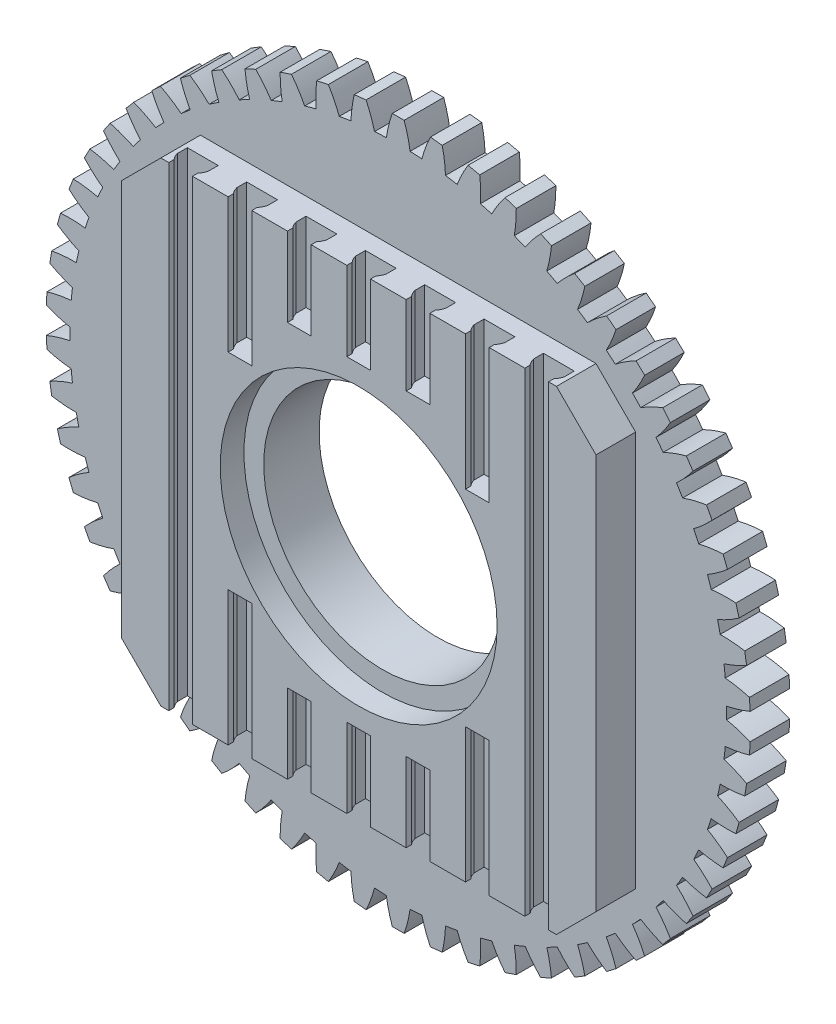
from build123d import *

# Parameters (mm, degrees)
SKETCH_1_R          = 41.5
EXTRUDE_1_DEPTH     = 5
SKETCH_2_W          = 60
SKETCH_2_H          = 60
EXTRUDE_2_DEPTH     = 5
CUT_EXTRUDE_1_DEPTH = 10
CUT_EXTRUDE_START   = -50
CUT_EXTRUDE_2_DEPTH = 10
CUT_EXTRUDE_3_DEPTH = 17
CUT_EXTRUDE_START_2 = -43
CUT_EXTRUDE_4_DEPTH = 17
CUT_EXTRUDE_5_REACH = 84.822
CHAMFER_1_SIZE      = 5
SKETCH_6_R          = 17.5
CUT_EXTRUDE_6_DEPTH = 3
SKETCH_7_R          = 15
CUT_EXTRUDE_7_DEPTH = 60.105837275
SKETCH_9_R          = 39.5
SKETCH_9_R_2        = 19
CUT_EXTRUDE_8_DEPTH = 3
EXTRUDE_START       = -5
EXTRUDE_3_DEPTH     = 5


with BuildPart() as part:
    # 草图1 → 凸台-拉伸1 (new body)
    with BuildSketch(Plane.XY):
        Circle(SKETCH_1_R)
    extrude(amount=-EXTRUDE_1_DEPTH)

    # 草图2 → 凸台-拉伸2 (add)
    with BuildSketch(Plane.XY):
        Rectangle(SKETCH_2_W, SKETCH_2_H)
    extrude(amount=EXTRUDE_2_DEPTH)

    # 草图3 → 切除-拉伸1 (cut)
    with BuildSketch(Plane.XZ.offset(30)):
        with BuildLine():
            Line((-1.5, 5), (1.5, 5))
            Line((1.5, 5), (1.5, 4.322875656))
            ThreePointArc((1.5, 4.322875656), (1.780042303, 3.911838473), (1.95, 3.444409721))
            Line((1.95, 3.444409721), (1.95, 2.2))
            Line((1.95, 2.2), (-1.95, 2.2))
            Line((-1.95, 2.2), (-1.95, 3.444409721))
            ThreePointArc((-1.95, 3.444409721), (-1.780042303, 3.911838473), (-1.5, 4.322875656))
            Line((-1.5, 4.322875656), (-1.5, 5))
        make_face()
        with BuildLine():
            Line((6, 5), (6, 4.322875656))
            ThreePointArc((6, 4.322875656), (5.719957697, 3.911838473), (5.55, 3.444409721))
            Line((5.55, 3.444409721), (5.55, 2.2))
            Line((5.55, 2.2), (9.45, 2.2))
            Line((9.45, 2.2), (9.45, 3.444409721))
            ThreePointArc((9.45, 3.444409721), (9.280042303, 3.911838473), (9, 4.322875656))
            Line((9, 4.322875656), (9, 5))
            Line((9, 5), (6, 5))
        make_face()
        with BuildLine():
            Line((-9, 5), (-9, 4.322875656))
            ThreePointArc((-9, 4.322875656), (-9.280042303, 3.911838473), (-9.45, 3.444409721))
            Line((-9.45, 3.444409721), (-9.45, 2.2))
            Line((-9.45, 2.2), (-5.55, 2.2))
            Line((-5.55, 2.2), (-5.55, 3.444409721))
            ThreePointArc((-5.55, 3.444409721), (-5.719957697, 3.911838473), (-6, 4.322875656))
            Line((-6, 4.322875656), (-6, 5))
            Line((-6, 5), (-9, 5))
        make_face()
    extrude(amount=-CUT_EXTRUDE_1_DEPTH, mode=Mode.SUBTRACT)

    # 草图3<2> → 切除-拉伸2 (cut)
    with BuildSketch(Plane.XZ.offset(30).offset(CUT_EXTRUDE_START)):
        with BuildLine():
            Line((-1.5, 5), (1.5, 5))
            Line((1.5, 5), (1.5, 4.322875656))
            ThreePointArc((1.5, 4.322875656), (1.780042303, 3.911838473), (1.95, 3.444409721))
            Line((1.95, 3.444409721), (1.95, 2.2))
            Line((1.95, 2.2), (-1.95, 2.2))
            Line((-1.95, 2.2), (-1.95, 3.444409721))
            ThreePointArc((-1.95, 3.444409721), (-1.780042303, 3.911838473), (-1.5, 4.322875656))
            Line((-1.5, 4.322875656), (-1.5, 5))
        make_face()
        with BuildLine():
            Line((6, 5), (6, 4.322875656))
            ThreePointArc((6, 4.322875656), (5.719957697, 3.911838473), (5.55, 3.444409721))
            Line((5.55, 3.444409721), (5.55, 2.2))
            Line((5.55, 2.2), (9.45, 2.2))
            Line((9.45, 2.2), (9.45, 3.444409721))
            ThreePointArc((9.45, 3.444409721), (9.280042303, 3.911838473), (9, 4.322875656))
            Line((9, 4.322875656), (9, 5))
            Line((9, 5), (6, 5))
        make_face()
        with BuildLine():
            Line((-9, 5), (-9, 4.322875656))
            ThreePointArc((-9, 4.322875656), (-9.280042303, 3.911838473), (-9.45, 3.444409721))
            Line((-9.45, 3.444409721), (-9.45, 2.2))
            Line((-9.45, 2.2), (-5.55, 2.2))
            Line((-5.55, 2.2), (-5.55, 3.444409721))
            ThreePointArc((-5.55, 3.444409721), (-5.719957697, 3.911838473), (-6, 4.322875656))
            Line((-6, 4.322875656), (-6, 5))
            Line((-6, 5), (-9, 5))
        make_face()
    extrude(amount=-CUT_EXTRUDE_2_DEPTH, mode=Mode.SUBTRACT)

    # 草图4 → 切除-拉伸3 (cut)
    with BuildSketch(Plane.XZ.offset(30)):
        with BuildLine():
            Line((-16.5, 5), (-13.5, 5))
            Line((-13.5, 5), (-13.5, 4.322875656))
            ThreePointArc((-13.5, 4.322875656), (-13.219957697, 3.911838473), (-13.05, 3.444409721))
            Line((-13.05, 3.444409721), (-13.05, 2.2))
            Line((-13.05, 2.2), (-16.95, 2.2))
            Line((-16.95, 2.2), (-16.95, 3.444409721))
            ThreePointArc((-16.95, 3.444409721), (-16.780042303, 3.911838473), (-16.5, 4.322875656))
            Line((-16.5, 4.322875656), (-16.5, 5))
        make_face()
        with BuildLine():
            Line((13.5, 5), (16.5, 5))
            Line((16.5, 5), (16.5, 4.322875656))
            ThreePointArc((16.5, 4.322875656), (16.780042303, 3.911838473), (16.95, 3.444409721))
            Line((16.95, 3.444409721), (16.95, 2.2))
            Line((16.95, 2.2), (13.05, 2.2))
            Line((13.05, 2.2), (13.05, 3.444409721))
            ThreePointArc((13.05, 3.444409721), (13.219957697, 3.911838473), (13.5, 4.322875656))
            Line((13.5, 4.322875656), (13.5, 5))
        make_face()
    extrude(amount=-CUT_EXTRUDE_3_DEPTH, mode=Mode.SUBTRACT)

    # 草图4<2> → 切除-拉伸4 (cut)
    with BuildSketch(Plane.XZ.offset(30).offset(CUT_EXTRUDE_START_2)):
        with BuildLine():
            Line((-16.5, 5), (-13.5, 5))
            Line((-13.5, 5), (-13.5, 4.322875656))
            ThreePointArc((-13.5, 4.322875656), (-13.219957697, 3.911838473), (-13.05, 3.444409721))
            Line((-13.05, 3.444409721), (-13.05, 2.2))
            Line((-13.05, 2.2), (-16.95, 2.2))
            Line((-16.95, 2.2), (-16.95, 3.444409721))
            ThreePointArc((-16.95, 3.444409721), (-16.780042303, 3.911838473), (-16.5, 4.322875656))
            Line((-16.5, 4.322875656), (-16.5, 5))
        make_face()
        with BuildLine():
            Line((13.5, 5), (16.5, 5))
            Line((16.5, 5), (16.5, 4.322875656))
            ThreePointArc((16.5, 4.322875656), (16.780042303, 3.911838473), (16.95, 3.444409721))
            Line((16.95, 3.444409721), (16.95, 2.2))
            Line((16.95, 2.2), (13.05, 2.2))
            Line((13.05, 2.2), (13.05, 3.444409721))
            ThreePointArc((13.05, 3.444409721), (13.219957697, 3.911838473), (13.5, 4.322875656))
            Line((13.5, 4.322875656), (13.5, 5))
        make_face()
    extrude(amount=-CUT_EXTRUDE_4_DEPTH, mode=Mode.SUBTRACT)

    # 草图5 → 切除-拉伸5 (cut, up to next)
    with BuildSketch(Plane.XZ.offset(30), mode=Mode.PRIVATE) as cut_extrude_5_sk1:
        with BuildLine():
            Line((-21, 5), (-21, 4.322875656))
            ThreePointArc((-21, 4.322875656), (-20.719957697, 3.911838473), (-20.55, 3.444409721))
            Line((-20.55, 3.444409721), (-20.55, 2.2))
            Line((-20.55, 2.2), (-24.45, 2.2))
            Line((-24.45, 2.2), (-24.45, 3.444409721))
            ThreePointArc((-24.45, 3.444409721), (-24.280042303, 3.911838473), (-24, 4.322875656))
            Line((-24, 4.322875656), (-24, 5))
            Line((-24, 5), (-21, 5))
        make_face()
    cut_extrude_5_tool1 = extrude(cut_extrude_5_sk1.sketch, amount=-CUT_EXTRUDE_5_REACH, mode=Mode.PRIVATE) & part.part
    # 草图5 → 切除-拉伸5 (cut, up to next)
    with BuildSketch(Plane.XZ.offset(30), mode=Mode.PRIVATE) as cut_extrude_5_sk2:
        with BuildLine():
            Line((24, 5), (24, 4.322875656))
            ThreePointArc((24, 4.322875656), (24.280042303, 3.911838473), (24.45, 3.444409721))
            Line((24.45, 3.444409721), (24.45, 2.2))
            Line((24.45, 2.2), (20.55, 2.2))
            Line((20.55, 2.2), (20.55, 3.444409721))
            ThreePointArc((20.55, 3.444409721), (20.719957697, 3.911838473), (21, 4.322875656))
            Line((21, 4.322875656), (21, 5))
            Line((21, 5), (24, 5))
        make_face()
    cut_extrude_5_tool2 = extrude(cut_extrude_5_sk2.sketch, amount=-CUT_EXTRUDE_5_REACH, mode=Mode.PRIVATE) & part.part
    add(cut_extrude_5_tool1.solids().sort_by_distance((-22.5, -30, 3.520698))[0], mode=Mode.SUBTRACT)
    add(cut_extrude_5_tool2.solids().sort_by_distance((22.5, -30, 3.520698))[0], mode=Mode.SUBTRACT)

    # 倒角1
    # the kernel refuses this chamfer: 5 mm, written as the material it takes off along each edge
    with BuildSketch(Plane(origin=(-30, 30, 0), x_dir=(0.9996219169112968, 0.027495876610586317, 0), z_dir=(0, 0, 1)), Plane(origin=(-30, -30, 0), x_dir=(-0.027495876610586317, 0.9996219169112968, 0), z_dir=(0, 0, 1)), Plane(origin=(30, 30, 0), x_dir=(0.027495876610586317, -0.9996219169112968, 0), z_dir=(0, 0, 1))) as chamfer_1_piece_1:
        Polygon((CHAMFER_1_SIZE * 0.999621916911, -CHAMFER_1_SIZE * 0.0274958766106), (-CHAMFER_1_SIZE * 0.0274958766106, -CHAMFER_1_SIZE * 0.999621916911), (0, 0), align=None)
    extrude(amount=17.85841494, mode=Mode.SUBTRACT)
    with BuildSketch(Plane(origin=(30, -30, 0), x_dir=(0.027495876610586317, 0.9996219169112968, 0), z_dir=(0, 0, 1))) as chamfer_1_piece_2:
        Polygon((CHAMFER_1_SIZE * 0.999621916911, CHAMFER_1_SIZE * 0.0274958766106), (-CHAMFER_1_SIZE * 0.0274958766106, CHAMFER_1_SIZE * 0.999621916911), (0, 0), align=None)
    extrude(amount=17.85841494, mode=Mode.SUBTRACT)

    # 草图6 → 切除-拉伸6 (cut)
    with BuildSketch(Plane.XY.offset(5)):
        Circle(SKETCH_6_R)
    extrude(amount=-CUT_EXTRUDE_6_DEPTH, mode=Mode.SUBTRACT)

    # 草图7 → 切除-拉伸7 (cut, through all)
    with BuildSketch(Plane.XY.offset(2)):
        Circle(SKETCH_7_R)
    extrude(amount=-CUT_EXTRUDE_7_DEPTH, mode=Mode.SUBTRACT)

    # 草图9 → 切除-拉伸8 (cut)
    with BuildSketch(Plane(origin=(0, 0, -5), x_dir=(-1, 0, 0), z_dir=(0, 0, -1))):
        Circle(SKETCH_9_R)
        Circle(SKETCH_9_R_2, mode=Mode.SUBTRACT)
    extrude(amount=-CUT_EXTRUDE_8_DEPTH, mode=Mode.SUBTRACT)

    # 草图8 → 凸台-拉伸3 (add)
    with BuildSketch(Plane(origin=(0, 0, -5), x_dir=(-1, 0, 0), z_dir=(0, 0, -1)).offset(EXTRUDE_START)):
        with BuildLine():
            Line((5.556899788, 44.15804983), (4.065692852, 44.320228357))
            ThreePointArc((4.065692852, 44.320228357), (3.457829001, 42.882253569), (2.992800434, 41.391945419))
            ThreePointArc((2.992800434, 41.391945419), (4.486939265, 41.256725222), (5.975214305, 41.067588364))
            ThreePointArc((5.975214305, 41.067588364), (5.841430046, 42.623021334), (5.556899788, 44.15804983))
        make_face()
        with BuildLine():
            Line((10.298650006, 43.298386899), (8.833719173, 43.620842559))
            ThreePointArc((8.833719173, 43.620842559), (8.073946223, 42.257018884), (7.450513019, 40.825725416))
            ThreePointArc((7.450513019, 40.825725416), (8.921273269, 40.529753062), (10.380374686, 40.180814096))
            ThreePointArc((10.380374686, 40.180814096), (10.415546562, 41.741593673), (10.298650006, 43.298386899))
        make_face()
        with BuildLine():
            Line((14.919657969, 41.93108997), (13.498178213, 42.410042265))
            ThreePointArc((13.498178213, 42.410042265), (12.595403808, 41.136359288), (11.820875151, 39.78086111))
            ThreePointArc((11.820875151, 39.78086111), (13.251013501, 39.327606604), (14.663834664, 38.82295652))
            ThreePointArc((14.663834664, 38.82295652), (14.867550317, 40.370783992), (14.919657969, 41.93108997))
        make_face()
        with BuildLine():
            Line((0.75, 44.5), (-0.75, 44.5))
            ThreePointArc((-0.75, 44.5), (-1.198828104, 43.004733039), (-1.5, 41.472882707))
            ThreePointArc((-1.5, 41.472882707), (0, 41.5), (1.5, 41.472882707))
            ThreePointArc((1.5, 41.472882707), (1.198828104, 43.004733039), (0.75, 44.5))
        make_face()
        with BuildLine():
            Line((19.365746584, 40.072189349), (18.004383455, 40.702023002))
            ThreePointArc((18.004383455, 40.702023002), (16.969191799, 39.533413491), (16.052648329, 38.26960258))
            ThreePointArc((16.052648329, 38.26960258), (17.425397715, 37.664379916), (18.775374588, 37.009935275))
            ThreePointArc((18.775374588, 37.009935275), (19.145245639, 38.52666378), (19.365746584, 40.072189349))
        make_face()
        with BuildLine():
            Line((23.584789527, 37.743478947), (22.299503762, 38.516809732))
            ThreePointArc((22.299503762, 38.516809732), (21.144031531, 37.466974567), (20.096218883, 36.309667949))
            ThreePointArc((20.096218883, 36.309667949), (21.395485073, 35.559572811), (22.666790412, 34.763006378))
            ThreePointArc((22.666790412, 34.763006378), (23.198480459, 36.23085366), (23.584789527, 37.743478947))
        make_face()
        with BuildLine():
            Line((27.527322375, 34.972260763), (26.333182777, 35.880022085))
            ThreePointArc((26.333182777, 35.880022085), (25.070976826, 34.961269622), (23.904179645, 33.92403566))
            ThreePointArc((23.904179645, 33.92403566), (25.114729931, 33.037862227), (26.292458842, 32.108513015))
            ThreePointArc((26.292458842, 32.108513015), (26.979734307, 33.510269908), (27.527322375, 34.972260763))
        make_face()
        with BuildLine():
            Line((31.147122538, 31.791024796), (30.0581293, 32.822573985))
            ThreePointArc((30.0581293, 32.822573985), (28.70398784, 32.045675756), (27.431885757, 31.14067507))
            ThreePointArc((27.431885757, 31.14067507), (28.539527542, 30.128812915), (29.609872232, 29.077576694))
            ThreePointArc((29.609872232, 29.077576694), (30.444675439, 30.396808879), (31.147122538, 31.791024796))
        make_face()
        with BuildLine():
            Line((34.401751167, 28.237068131), (33.43067174, 29.380311214))
            ThreePointArc((33.43067174, 29.380311214), (32.000470841, 28.754375642), (30.637978089, 27.992218537))
            ThreePointArc((30.637978089, 27.992218537), (31.629725288, 26.866530818), (32.580136943, 25.705732372))
            ThreePointArc((32.580136943, 25.705732372), (33.552680586, 26.926973058), (34.401751167, 28.237068131))
        make_face()
        with BuildLine():
            Line((37.253050717, 24.35205766), (36.411270119, 25.593591157))
            ThreePointArc((36.411270119, 25.593591157), (34.921777579, 25.125956764), (33.48486814, 24.515578836))
            ThreePointArc((33.48486814, 24.515578836), (34.349093424, 23.289263213), (35.168429336, 22.032511841))
            ThreePointArc((35.168429336, 22.032511841), (36.267311231, 23.141443098), (37.253050717, 24.35205766))
        make_face()
        with BuildLine():
            Line((39.667592308, 20.181541578), (38.964979647, 21.506809644))
            ThreePointArc((38.964979647, 21.506809644), (37.433658405, 21.202959015), (35.939178728, 20.751516387))
            ThreePointArc((35.939178728, 20.751516387), (36.665749845, 19.438950289), (37.34440405, 18.100980253))
            ThreePointArc((37.34440405, 18.100980253), (38.556740811, 19.084600876), (39.667592308, 20.181541578))
        make_face()
        with BuildLine():
            Line((41.617067648, 15.774415373), (41.061860415, 17.167880452))
            ThreePointArc((41.061860415, 17.167880452), (39.506663812, 17.031375958), (37.972135305, 16.744161381))
            ThreePointArc((37.972135305, 16.744161381), (38.552533872, 15.360733447), (39.082549771, 13.957231222))
            ThreePointArc((39.082549771, 13.957231222), (40.394127858, 14.804009158), (41.617067648, 15.774415373))
        make_face()
        with BuildLine():
            Line((43.078620921, 11.18234857), (42.677328413, 12.627673559))
            ThreePointArc((42.677328413, 12.627673559), (41.116489707, 12.66011559), (39.559903314, 12.540496393))
            ThreePointArc((39.559903314, 12.540496393), (39.98732469, 11.102426049), (40.36248833, 9.649846416))
            ThreePointArc((40.36248833, 9.649846416), (41.757930689, 10.349853968), (43.078620921, 11.18234857))
        make_face()
        with BuildLine():
            Line((44.035116751, 6.459178955), (43.792443756, 7.939418739))
            ThreePointArc((43.792443756, 7.939418739), (42.244262354, 8.140426942), (40.683867626, 8.189805551))
            ThreePointArc((40.683867626, 8.189805551), (40.953300685, 6.713952857), (41.169213616, 5.229325983))
            ThreePointArc((41.169213616, 5.229325983), (42.632159962, 5.774356203), (44.035116751, 6.459178955))
        make_face()
        with BuildLine():
            Line((44.475341098, 1.660281372), (44.394132735, 3.158081492))
            ThreePointArc((44.394132735, 3.158081492), (42.876759648, 3.52529923), (41.330850788, 3.743096726))
            ThreePointArc((41.330850788, 3.743096726), (41.439136675, 2.246764706), (41.493267514, 0.747496485))
            ThreePointArc((41.493267514, 0.747496485), (43.006566138, 1.131159391), (44.475341098, 1.660281372))
        make_face()
        with BuildLine():
            Line((44.394132735, -3.158081492), (44.475341098, -1.660281372))
            ThreePointArc((44.475341098, -1.660281372), (43.006566138, -1.131159391), (41.493267514, -0.747496485))
            ThreePointArc((41.493267514, -0.747496485), (41.439136675, -2.246764706), (41.330850788, -3.743096726))
            ThreePointArc((41.330850788, -3.743096726), (42.876759648, -3.52529923), (44.394132735, -3.158081492))
        make_face()
        with BuildLine():
            Line((43.792443756, -7.939418739), (44.035116751, -6.459178955))
            ThreePointArc((44.035116751, -6.459178955), (42.632159962, -5.774356203), (41.169213616, -5.229325983))
            ThreePointArc((41.169213616, -5.229325983), (40.953300685, -6.713952857), (40.683867626, -8.189805551))
            ThreePointArc((40.683867626, -8.189805551), (42.244262354, -8.140426942), (43.792443756, -7.939418739))
        make_face()
        with BuildLine():
            Line((42.677328413, -12.627673559), (43.078620921, -11.18234857))
            ThreePointArc((43.078620921, -11.18234857), (41.757930689, -10.349853968), (40.36248833, -9.649846416))
            ThreePointArc((40.36248833, -9.649846416), (39.98732469, -11.102426049), (39.559903314, -12.540496393))
            ThreePointArc((39.559903314, -12.540496393), (41.116489707, -12.66011559), (42.677328413, -12.627673559))
        make_face()
        with BuildLine():
            Line((41.061860415, -17.167880452), (41.617067648, -15.774415373))
            ThreePointArc((41.617067648, -15.774415373), (40.394127858, -14.804009158), (39.082549771, -13.957231222))
            ThreePointArc((39.082549771, -13.957231222), (38.552533872, -15.360733447), (37.972135305, -16.744161381))
            ThreePointArc((37.972135305, -16.744161381), (39.506663812, -17.031375958), (41.061860415, -17.167880452))
        make_face()
        with BuildLine():
            Line((38.964979647, -21.506809644), (39.667592308, -20.181541578))
            ThreePointArc((39.667592308, -20.181541578), (38.556740811, -19.084600876), (37.34440405, -18.100980253))
            ThreePointArc((37.34440405, -18.100980253), (36.665749845, -19.438950289), (35.939178728, -20.751516387))
            ThreePointArc((35.939178728, -20.751516387), (37.433658405, -21.202959015), (38.964979647, -21.506809644))
        make_face()
        with BuildLine():
            Line((36.411270119, -25.593591157), (37.253050717, -24.35205766))
            ThreePointArc((37.253050717, -24.35205766), (36.267311231, -23.141443098), (35.168429336, -22.032511841))
            ThreePointArc((35.168429336, -22.032511841), (34.349093424, -23.289263213), (33.48486814, -24.515578836))
            ThreePointArc((33.48486814, -24.515578836), (34.921777579, -25.125956764), (36.411270119, -25.593591157))
        make_face()
        with BuildLine():
            Line((33.43067174, -29.380311214), (34.401751167, -28.237068131))
            ThreePointArc((34.401751167, -28.237068131), (33.552680586, -26.926973058), (32.580136943, -25.705732372))
            ThreePointArc((32.580136943, -25.705732372), (31.629725288, -26.866530818), (30.637978089, -27.992218537))
            ThreePointArc((30.637978089, -27.992218537), (32.000470841, -28.754375642), (33.43067174, -29.380311214))
        make_face()
        with BuildLine():
            Line((30.0581293, -32.822573985), (31.147122538, -31.791024796))
            ThreePointArc((31.147122538, -31.791024796), (30.444675439, -30.396808879), (29.609872232, -29.077576694))
            ThreePointArc((29.609872232, -29.077576694), (28.539527542, -30.128812915), (27.431885757, -31.14067507))
            ThreePointArc((27.431885757, -31.14067507), (28.70398784, -32.045675756), (30.0581293, -32.822573985))
        make_face()
        with BuildLine():
            Line((26.333182777, -35.880022085), (27.527322375, -34.972260763))
            ThreePointArc((27.527322375, -34.972260763), (26.979734307, -33.510269908), (26.292458842, -32.108513015))
            ThreePointArc((26.292458842, -32.108513015), (25.114729931, -33.037862227), (23.904179645, -33.92403566))
            ThreePointArc((23.904179645, -33.92403566), (25.070976826, -34.961269622), (26.333182777, -35.880022085))
        make_face()
        with BuildLine():
            Line((22.299503762, -38.516809732), (23.584789527, -37.743478947))
            ThreePointArc((23.584789527, -37.743478947), (23.198480459, -36.23085366), (22.666790412, -34.763006378))
            ThreePointArc((22.666790412, -34.763006378), (21.395485073, -35.559572811), (20.096218883, -36.309667949))
            ThreePointArc((20.096218883, -36.309667949), (21.144031531, -37.466974567), (22.299503762, -38.516809732))
        make_face()
        with BuildLine():
            Line((18.004383455, -40.702023002), (19.365746584, -40.072189349))
            ThreePointArc((19.365746584, -40.072189349), (19.145245639, -38.52666378), (18.775374588, -37.009935275))
            ThreePointArc((18.775374588, -37.009935275), (17.425397715, -37.664379916), (16.052648329, -38.26960258))
            ThreePointArc((16.052648329, -38.26960258), (16.969191799, -39.533413491), (18.004383455, -40.702023002))
        make_face()
        with BuildLine():
            Line((13.498178213, -42.410042265), (14.919657969, -41.93108997))
            ThreePointArc((14.919657969, -41.93108997), (14.867550317, -40.370783992), (14.663834664, -38.82295652))
            ThreePointArc((14.663834664, -38.82295652), (13.251013501, -39.327606604), (11.820875151, -39.78086111))
            ThreePointArc((11.820875151, -39.78086111), (12.595403808, -41.136359288), (13.498178213, -42.410042265))
        make_face()
        with BuildLine():
            Line((8.833719173, -43.620842559), (10.298650006, -43.298386899))
            ThreePointArc((10.298650006, -43.298386899), (10.415546562, -41.741593673), (10.380374686, -40.180814096))
            ThreePointArc((10.380374686, -40.180814096), (8.921273269, -40.529753062), (7.450513019, -40.825725416))
            ThreePointArc((7.450513019, -40.825725416), (8.073946223, -42.257018884), (8.833719173, -43.620842559))
        make_face()
        with BuildLine():
            Line((4.065692852, -44.320228357), (5.556899788, -44.15804983))
            ThreePointArc((5.556899788, -44.15804983), (5.841430046, -42.623021334), (5.975214305, -41.067588364))
            ThreePointArc((5.975214305, -41.067588364), (4.486939265, -41.256725222), (2.992800434, -41.391945419))
            ThreePointArc((2.992800434, -41.391945419), (3.457829001, -42.882253569), (4.065692852, -44.320228357))
        make_face()
        with BuildLine():
            Line((-0.75, -44.5), (0.75, -44.5))
            ThreePointArc((0.75, -44.5), (1.198828104, -43.004733039), (1.5, -41.472882707))
            ThreePointArc((1.5, -41.472882707), (0, -41.5), (-1.5, -41.472882707))
            ThreePointArc((-1.5, -41.472882707), (-1.198828104, -43.004733039), (-0.75, -44.5))
        make_face()
        with BuildLine():
            Line((-5.556899788, -44.15804983), (-4.065692852, -44.320228357))
            ThreePointArc((-4.065692852, -44.320228357), (-3.457829001, -42.882253569), (-2.992800434, -41.391945419))
            ThreePointArc((-2.992800434, -41.391945419), (-4.486939265, -41.256725222), (-5.975214305, -41.067588364))
            ThreePointArc((-5.975214305, -41.067588364), (-5.841430046, -42.623021334), (-5.556899788, -44.15804983))
        make_face()
        with BuildLine():
            Line((-10.298650006, -43.298386899), (-8.833719173, -43.620842559))
            ThreePointArc((-8.833719173, -43.620842559), (-8.073946223, -42.257018884), (-7.450513019, -40.825725416))
            ThreePointArc((-7.450513019, -40.825725416), (-8.921273269, -40.529753062), (-10.380374686, -40.180814096))
            ThreePointArc((-10.380374686, -40.180814096), (-10.415546562, -41.741593673), (-10.298650006, -43.298386899))
        make_face()
        with BuildLine():
            Line((-14.919657969, -41.93108997), (-13.498178213, -42.410042265))
            ThreePointArc((-13.498178213, -42.410042265), (-12.595403808, -41.136359288), (-11.820875151, -39.78086111))
            ThreePointArc((-11.820875151, -39.78086111), (-13.251013501, -39.327606604), (-14.663834664, -38.82295652))
            ThreePointArc((-14.663834664, -38.82295652), (-14.867550317, -40.370783992), (-14.919657969, -41.93108997))
        make_face()
        with BuildLine():
            Line((-19.365746584, -40.072189349), (-18.004383455, -40.702023002))
            ThreePointArc((-18.004383455, -40.702023002), (-16.969191799, -39.533413491), (-16.052648329, -38.26960258))
            ThreePointArc((-16.052648329, -38.26960258), (-17.425397715, -37.664379916), (-18.775374588, -37.009935275))
            ThreePointArc((-18.775374588, -37.009935275), (-19.145245639, -38.52666378), (-19.365746584, -40.072189349))
        make_face()
        with BuildLine():
            Line((-23.584789527, -37.743478947), (-22.299503762, -38.516809732))
            ThreePointArc((-22.299503762, -38.516809732), (-21.144031531, -37.466974567), (-20.096218883, -36.309667949))
            ThreePointArc((-20.096218883, -36.309667949), (-21.395485073, -35.559572811), (-22.666790412, -34.763006378))
            ThreePointArc((-22.666790412, -34.763006378), (-23.198480459, -36.23085366), (-23.584789527, -37.743478947))
        make_face()
        with BuildLine():
            Line((-27.527322375, -34.972260763), (-26.333182777, -35.880022085))
            ThreePointArc((-26.333182777, -35.880022085), (-25.070976826, -34.961269622), (-23.904179645, -33.92403566))
            ThreePointArc((-23.904179645, -33.92403566), (-25.114729931, -33.037862227), (-26.292458842, -32.108513015))
            ThreePointArc((-26.292458842, -32.108513015), (-26.979734307, -33.510269908), (-27.527322375, -34.972260763))
        make_face()
        with BuildLine():
            Line((-31.147122538, -31.791024796), (-30.0581293, -32.822573985))
            ThreePointArc((-30.0581293, -32.822573985), (-28.70398784, -32.045675756), (-27.431885757, -31.14067507))
            ThreePointArc((-27.431885757, -31.14067507), (-28.539527542, -30.128812915), (-29.609872232, -29.077576694))
            ThreePointArc((-29.609872232, -29.077576694), (-30.444675439, -30.396808879), (-31.147122538, -31.791024796))
        make_face()
        with BuildLine():
            Line((-34.401751167, -28.237068131), (-33.43067174, -29.380311214))
            ThreePointArc((-33.43067174, -29.380311214), (-32.000470841, -28.754375642), (-30.637978089, -27.992218537))
            ThreePointArc((-30.637978089, -27.992218537), (-31.629725288, -26.866530818), (-32.580136943, -25.705732372))
            ThreePointArc((-32.580136943, -25.705732372), (-33.552680586, -26.926973058), (-34.401751167, -28.237068131))
        make_face()
        with BuildLine():
            Line((-37.253050717, -24.35205766), (-36.411270119, -25.593591157))
            ThreePointArc((-36.411270119, -25.593591157), (-34.921777579, -25.125956764), (-33.48486814, -24.515578836))
            ThreePointArc((-33.48486814, -24.515578836), (-34.349093424, -23.289263213), (-35.168429336, -22.032511841))
            ThreePointArc((-35.168429336, -22.032511841), (-36.267311231, -23.141443098), (-37.253050717, -24.35205766))
        make_face()
        with BuildLine():
            Line((-39.667592308, -20.181541578), (-38.964979647, -21.506809644))
            ThreePointArc((-38.964979647, -21.506809644), (-37.433658405, -21.202959015), (-35.939178728, -20.751516387))
            ThreePointArc((-35.939178728, -20.751516387), (-36.665749845, -19.438950289), (-37.34440405, -18.100980253))
            ThreePointArc((-37.34440405, -18.100980253), (-38.556740811, -19.084600876), (-39.667592308, -20.181541578))
        make_face()
        with BuildLine():
            Line((-41.617067648, -15.774415373), (-41.061860415, -17.167880452))
            ThreePointArc((-41.061860415, -17.167880452), (-39.506663812, -17.031375958), (-37.972135305, -16.744161381))
            ThreePointArc((-37.972135305, -16.744161381), (-38.552533872, -15.360733447), (-39.082549771, -13.957231222))
            ThreePointArc((-39.082549771, -13.957231222), (-40.394127858, -14.804009158), (-41.617067648, -15.774415373))
        make_face()
        with BuildLine():
            Line((-43.078620921, -11.18234857), (-42.677328413, -12.627673559))
            ThreePointArc((-42.677328413, -12.627673559), (-41.116489707, -12.66011559), (-39.559903314, -12.540496393))
            ThreePointArc((-39.559903314, -12.540496393), (-39.98732469, -11.102426049), (-40.36248833, -9.649846416))
            ThreePointArc((-40.36248833, -9.649846416), (-41.757930689, -10.349853968), (-43.078620921, -11.18234857))
        make_face()
        with BuildLine():
            Line((-44.035116751, -6.459178955), (-43.792443756, -7.939418739))
            ThreePointArc((-43.792443756, -7.939418739), (-42.244262354, -8.140426942), (-40.683867626, -8.189805551))
            ThreePointArc((-40.683867626, -8.189805551), (-40.953300685, -6.713952857), (-41.169213616, -5.229325983))
            ThreePointArc((-41.169213616, -5.229325983), (-42.632159962, -5.774356203), (-44.035116751, -6.459178955))
        make_face()
        with BuildLine():
            Line((-44.475341098, -1.660281372), (-44.394132735, -3.158081492))
            ThreePointArc((-44.394132735, -3.158081492), (-42.876759648, -3.52529923), (-41.330850788, -3.743096726))
            ThreePointArc((-41.330850788, -3.743096726), (-41.439136675, -2.246764706), (-41.493267514, -0.747496485))
            ThreePointArc((-41.493267514, -0.747496485), (-43.006566138, -1.131159391), (-44.475341098, -1.660281372))
        make_face()
        with BuildLine():
            Line((-44.394132735, 3.158081492), (-44.475341098, 1.660281372))
            ThreePointArc((-44.475341098, 1.660281372), (-43.006566138, 1.131159391), (-41.493267514, 0.747496485))
            ThreePointArc((-41.493267514, 0.747496485), (-41.439136675, 2.246764706), (-41.330850788, 3.743096726))
            ThreePointArc((-41.330850788, 3.743096726), (-42.876759648, 3.52529923), (-44.394132735, 3.158081492))
        make_face()
        with BuildLine():
            Line((-43.792443756, 7.939418739), (-44.035116751, 6.459178955))
            ThreePointArc((-44.035116751, 6.459178955), (-42.632159962, 5.774356203), (-41.169213616, 5.229325983))
            ThreePointArc((-41.169213616, 5.229325983), (-40.953300685, 6.713952857), (-40.683867626, 8.189805551))
            ThreePointArc((-40.683867626, 8.189805551), (-42.244262354, 8.140426942), (-43.792443756, 7.939418739))
        make_face()
        with BuildLine():
            Line((-42.677328413, 12.627673559), (-43.078620921, 11.18234857))
            ThreePointArc((-43.078620921, 11.18234857), (-41.757930689, 10.349853968), (-40.36248833, 9.649846416))
            ThreePointArc((-40.36248833, 9.649846416), (-39.98732469, 11.102426049), (-39.559903314, 12.540496393))
            ThreePointArc((-39.559903314, 12.540496393), (-41.116489707, 12.66011559), (-42.677328413, 12.627673559))
        make_face()
        with BuildLine():
            Line((-41.061860415, 17.167880452), (-41.617067648, 15.774415373))
            ThreePointArc((-41.617067648, 15.774415373), (-40.394127858, 14.804009158), (-39.082549771, 13.957231222))
            ThreePointArc((-39.082549771, 13.957231222), (-38.552533872, 15.360733447), (-37.972135305, 16.744161381))
            ThreePointArc((-37.972135305, 16.744161381), (-39.506663812, 17.031375958), (-41.061860415, 17.167880452))
        make_face()
        with BuildLine():
            Line((-38.964979647, 21.506809644), (-39.667592308, 20.181541578))
            ThreePointArc((-39.667592308, 20.181541578), (-38.556740811, 19.084600876), (-37.34440405, 18.100980253))
            ThreePointArc((-37.34440405, 18.100980253), (-36.665749845, 19.438950289), (-35.939178728, 20.751516387))
            ThreePointArc((-35.939178728, 20.751516387), (-37.433658405, 21.202959015), (-38.964979647, 21.506809644))
        make_face()
        with BuildLine():
            Line((-36.411270119, 25.593591157), (-37.253050717, 24.35205766))
            ThreePointArc((-37.253050717, 24.35205766), (-36.267311231, 23.141443098), (-35.168429336, 22.032511841))
            ThreePointArc((-35.168429336, 22.032511841), (-34.349093424, 23.289263213), (-33.48486814, 24.515578836))
            ThreePointArc((-33.48486814, 24.515578836), (-34.921777579, 25.125956764), (-36.411270119, 25.593591157))
        make_face()
        with BuildLine():
            Line((-33.43067174, 29.380311214), (-34.401751167, 28.237068131))
            ThreePointArc((-34.401751167, 28.237068131), (-33.552680586, 26.926973058), (-32.580136943, 25.705732372))
            ThreePointArc((-32.580136943, 25.705732372), (-31.629725288, 26.866530818), (-30.637978089, 27.992218537))
            ThreePointArc((-30.637978089, 27.992218537), (-32.000470841, 28.754375642), (-33.43067174, 29.380311214))
        make_face()
        with BuildLine():
            Line((-30.0581293, 32.822573985), (-31.147122538, 31.791024796))
            ThreePointArc((-31.147122538, 31.791024796), (-30.444675439, 30.396808879), (-29.609872232, 29.077576694))
            ThreePointArc((-29.609872232, 29.077576694), (-28.539527542, 30.128812915), (-27.431885757, 31.14067507))
            ThreePointArc((-27.431885757, 31.14067507), (-28.70398784, 32.045675756), (-30.0581293, 32.822573985))
        make_face()
        with BuildLine():
            Line((-26.333182777, 35.880022085), (-27.527322375, 34.972260763))
            ThreePointArc((-27.527322375, 34.972260763), (-26.979734307, 33.510269908), (-26.292458842, 32.108513015))
            ThreePointArc((-26.292458842, 32.108513015), (-25.114729931, 33.037862227), (-23.904179645, 33.92403566))
            ThreePointArc((-23.904179645, 33.92403566), (-25.070976826, 34.961269622), (-26.333182777, 35.880022085))
        make_face()
        with BuildLine():
            Line((-22.299503762, 38.516809732), (-23.584789527, 37.743478947))
            ThreePointArc((-23.584789527, 37.743478947), (-23.198480459, 36.23085366), (-22.666790412, 34.763006378))
            ThreePointArc((-22.666790412, 34.763006378), (-21.395485073, 35.559572811), (-20.096218883, 36.309667949))
            ThreePointArc((-20.096218883, 36.309667949), (-21.144031531, 37.466974567), (-22.299503762, 38.516809732))
        make_face()
        with BuildLine():
            Line((-18.004383455, 40.702023002), (-19.365746584, 40.072189349))
            ThreePointArc((-19.365746584, 40.072189349), (-19.145245639, 38.52666378), (-18.775374588, 37.009935275))
            ThreePointArc((-18.775374588, 37.009935275), (-17.425397715, 37.664379916), (-16.052648329, 38.26960258))
            ThreePointArc((-16.052648329, 38.26960258), (-16.969191799, 39.533413491), (-18.004383455, 40.702023002))
        make_face()
        with BuildLine():
            Line((-13.498178213, 42.410042265), (-14.919657969, 41.93108997))
            ThreePointArc((-14.919657969, 41.93108997), (-14.867550317, 40.370783992), (-14.663834664, 38.82295652))
            ThreePointArc((-14.663834664, 38.82295652), (-13.251013501, 39.327606604), (-11.820875151, 39.78086111))
            ThreePointArc((-11.820875151, 39.78086111), (-12.595403808, 41.136359288), (-13.498178213, 42.410042265))
        make_face()
        with BuildLine():
            Line((-8.833719173, 43.620842559), (-10.298650006, 43.298386899))
            ThreePointArc((-10.298650006, 43.298386899), (-10.415546562, 41.741593673), (-10.380374686, 40.180814096))
            ThreePointArc((-10.380374686, 40.180814096), (-8.921273269, 40.529753062), (-7.450513019, 40.825725416))
            ThreePointArc((-7.450513019, 40.825725416), (-8.073946223, 42.257018884), (-8.833719173, 43.620842559))
        make_face()
        with BuildLine():
            Line((-4.065692852, 44.320228357), (-5.556899788, 44.15804983))
            ThreePointArc((-5.556899788, 44.15804983), (-5.841430046, 42.623021334), (-5.975214305, 41.067588364))
            ThreePointArc((-5.975214305, 41.067588364), (-4.486939265, 41.256725222), (-2.992800434, 41.391945419))
            ThreePointArc((-2.992800434, 41.391945419), (-3.457829001, 42.882253569), (-4.065692852, 44.320228357))
        make_face()
    extrude(amount=EXTRUDE_3_DEPTH)


solid = part.part
